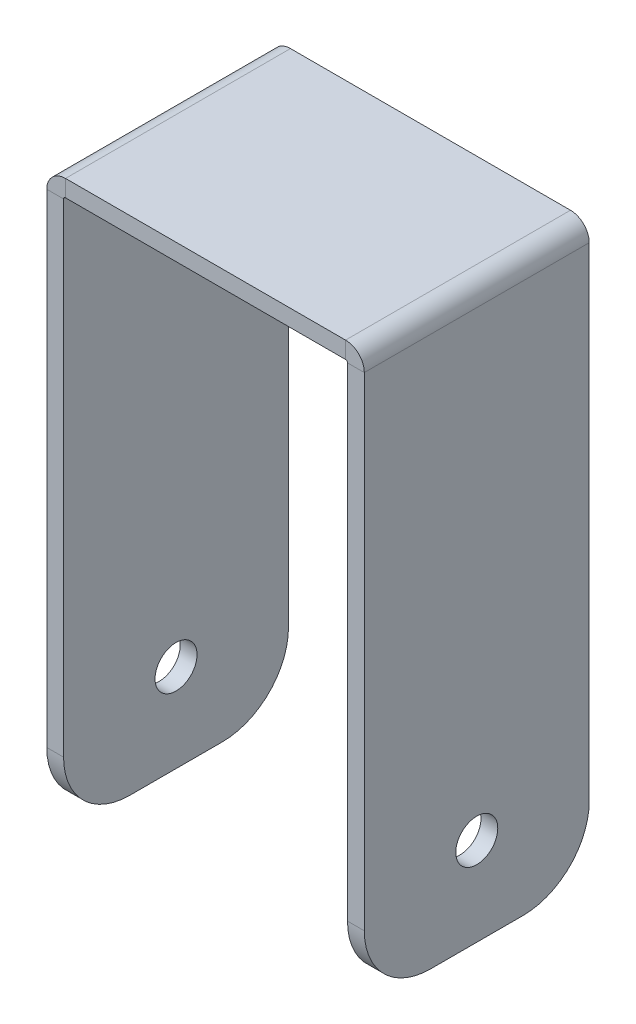
from build123d import *

# Parameters (mm, degrees)
SKETCH3_W                    = 120
SKETCH3_H                    = 85
BASE_FLANGE1_DEPTH           = 6.35
EDGE_FLANGE1_STRIP_W         = 26.8732
EDGE_FLANGE1_STRIP_H         = 6.35
EDGE_FLANGE1_STRIP_CUT_DEPTH = 85
EDGE_FLANGE1_DEPTH           = 85
EDGE_FLANGE1_PROFILE_W       = 85
EDGE_FLANGE1_PROFILE_H       = 207.7009
EDGE_FLANGE1_PROFILE_R       = 7.9375
EDGE_FLANGE1_FLAT_DEPTH      = 6.35
FILLET1_R                    = 25


# Sheet-metal steps are written as plain solids
with BuildPart() as part:
    # Sketch3 → Base-Flange1 (new body)
    with BuildSketch(Plane(origin=(0, 0, 0), x_dir=(1, 0, 0), z_dir=(0, 1, 0))):
        Rectangle(SKETCH3_W, SKETCH3_H)
    extrude(amount=-BASE_FLANGE1_DEPTH)

    # Edge-Flange1 strip (across the edge) → Edge-Flange1 strip cut (cut)
    with BuildSketch(Plane(origin=(60, -6.35, -42.5), x_dir=(-1, 0, 0), z_dir=(0, 0, 1))):
        with Locations((-6.35, -3.175)):
            Rectangle(EDGE_FLANGE1_STRIP_W, EDGE_FLANGE1_STRIP_H)
    edge_flange1_strip_cut = extrude(amount=EDGE_FLANGE1_STRIP_CUT_DEPTH, mode=Mode.SUBTRACT)

    # Edge-Flange1 bend section (across the edge) → Edge-Flange1 (add)
    with BuildSketch(Plane(origin=(60, -6.35, -42.5), x_dir=(-1, 0, 0), z_dir=(0, 0, 1))):
        with BuildLine():
            Line((0, 0.7366), (6.35, 0.7366))
            ThreePointArc((6.35, 0.7366), (6.565745145, 0.215745145), (7.0866, 0))
            Line((7.0866, 0), (7.0866, -6.35))
            ThreePointArc((7.0866, -6.35), (2.075617084, -4.274382916), (0, 0.7366))
        make_face()
    edge_flange1 = extrude(amount=EDGE_FLANGE1_DEPTH)

    # Edge-Flange1 profile (on flange) → Edge-Flange1 flat (add)
    with BuildSketch(Plane(origin=(60, -6.35, 0), x_dir=(0, 0, -1), z_dir=(-1, 0, 0))):
        with Locations((0, 104.58705)):
            Rectangle(EDGE_FLANGE1_PROFILE_W, EDGE_FLANGE1_PROFILE_H)
        with Locations((0, 175.1)):
            Circle(EDGE_FLANGE1_PROFILE_R, mode=Mode.SUBTRACT)
    edge_flange1_flat = extrude(amount=EDGE_FLANGE1_FLAT_DEPTH)

    # Mirror1: Edge-Flange1 strip cut, Edge-Flange1, Edge-Flange1 flat across plane
    add(edge_flange1_strip_cut.mirror(Plane(origin=(0, 0, 0), x_dir=(0, 0, 1), z_dir=(1, 0, 0))), mode=Mode.SUBTRACT)
    add(edge_flange1.mirror(Plane(origin=(0, 0, 0), x_dir=(0, 0, 1), z_dir=(1, 0, 0))))
    add(edge_flange1_flat.mirror(Plane(origin=(0, 0, 0), x_dir=(0, 0, 1), z_dir=(1, 0, 0))))

    # Fillet1
    fillet1_edges = [part.edges().sort_by_distance(p)[0] for p in [
        (56.825, -214.7875, -42.5),
        (56.825, -214.7875, 42.5),
        (-56.825, -214.7875, 42.5),
        (-56.825, -214.7875, -42.5),
    ]]
    fillet(fillet1_edges, radius=FILLET1_R)


solid = part.part
